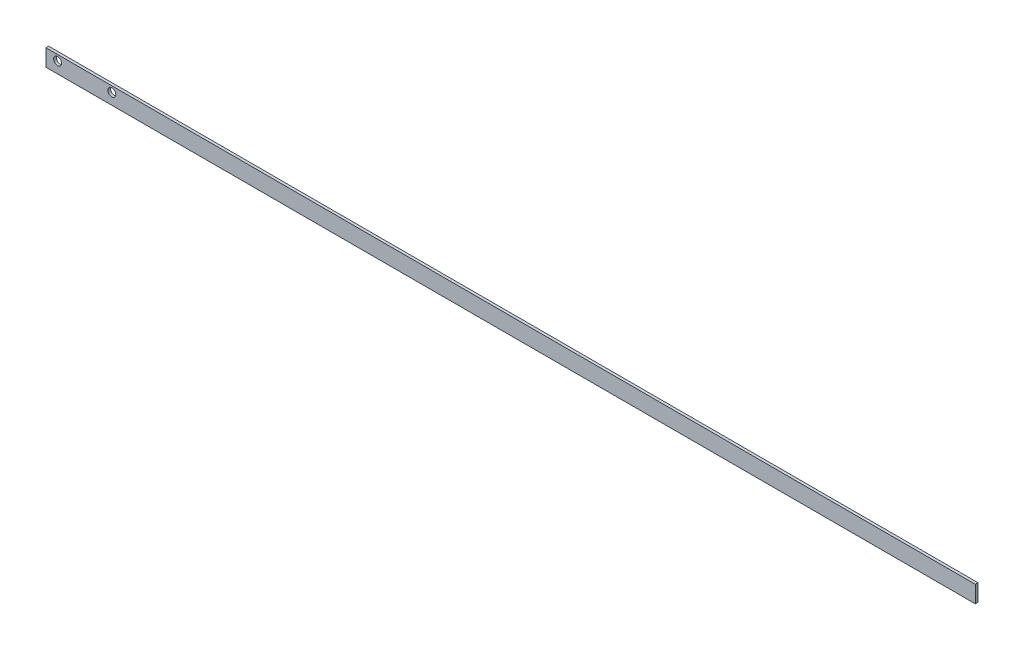
from build123d import *

# Parameters (mm, degrees)
SKETCH1_W                  = 609.6
SKETCH1_H                  = 11.0998
BOSS_EXTRUDE1_DEPTH        = 0.889
F_6_0_204_DIAMETER_HOLE1_D = 5.1816


with BuildPart() as part:
    # Sketch1 → Boss-Extrude1 (new, symmetric)
    with BuildSketch(Plane.XY):
        Rectangle(SKETCH1_W, SKETCH1_H)
    extrude(amount=BOSS_EXTRUDE1_DEPTH, both=True)

    # #6 (0.204) Diameter Hole1 (through all)
    with Locations(Plane.XY.offset(0.889)):
        with Locations((-297.18, 1.7399), (-261.62, 1.7399)):
            Hole(F_6_0_204_DIAMETER_HOLE1_D / 2)


solid = part.part
